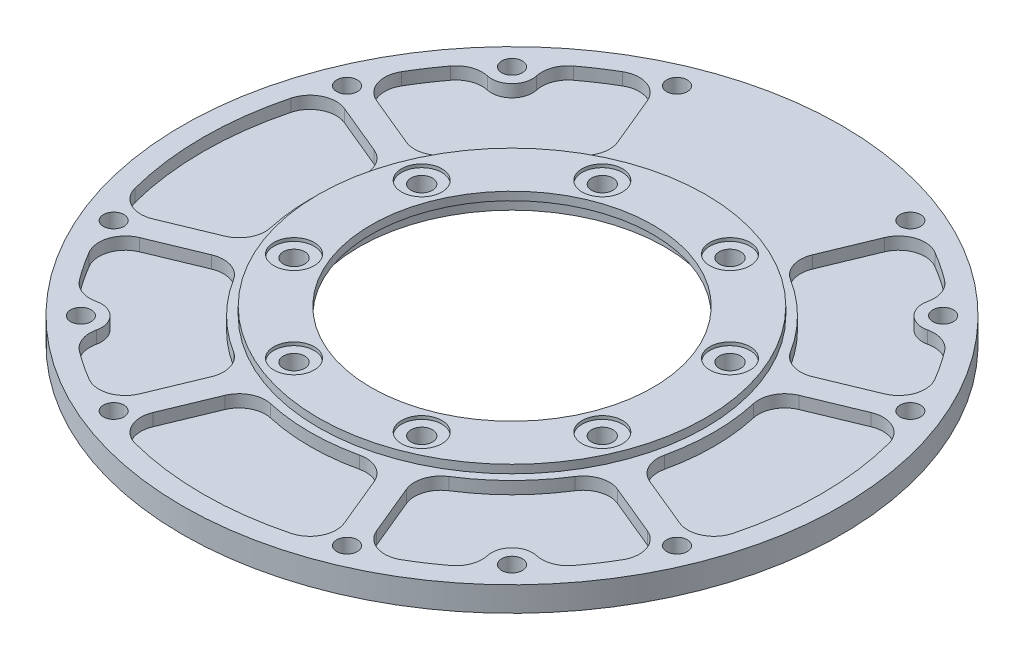
from build123d import *

# Parameters (mm, degrees)
SKETCH_2_R               = 40
EXTRUDE_1_DEPTH          = 4
SKETCH_3_R               = 23.5
EXTRUDE_2_DEPTH          = 1
SKETCH_4_R               = 17.1
CUT_EXTRUDE_1_DEPTH      = 57.789083458
SKETCH_5_R               = 33.5
CUT_EXTRUDE_2_DEPTH      = 1
SKETCH_6_R               = 22.1
CUT_EXTRUDE_3_DEPTH      = 1
SKETCH_7_R               = 18.52
CUT_EXTRUDE_4_DEPTH      = 2
HOLE_WIZARD_M3_1_D       = 2.5
CUT_EXTRUDE_5_DEPTH      = 1.5
PATTERN_CIRCULAR_1_COUNT = 2
PATTERN_CIRCULAR_1_ANGLE = 90
F_1_THE_OTHER_WAY_COUNT  = 2
F_1_THE_OTHER_WAY_ANGLE  = 90
CUT_EXTRUDE_6_DEPTH      = 1.5
PATTERN_CIRCULAR_2_COUNT = 4
CUT_EXTRUDE_7_DEPTH      = 3
FILLET_1_DEPTH           = 2
SKETCH_17_R              = 2.45
CUT_EXTRUDE_8_DEPTH      = 0.4
SKETCH_18_R              = 1.3
CUT_EXTRUDE_9_DEPTH      = 57.755264073
PATTERN_CIRCULAR_3_COUNT = 8
SKETCH_19_W              = 100
SKETCH_19_H              = 100
CUT_EXTRUDE_11_DEPTH     = 1


with BuildPart() as part:
    # 草图2 → 凸台-拉伸1 (new body)
    with BuildSketch(Plane(origin=(0, 0, 0), x_dir=(1, 0, 0), z_dir=(0, 1, 0))):
        with Locations(Location((0, 0, 0), (0, 0, 270))):
            Circle(SKETCH_2_R)
    extrude(amount=EXTRUDE_1_DEPTH)

    # 草图3 → 凸台-拉伸2 (add)
    with BuildSketch(Plane(origin=(0, 4, 0), x_dir=(1, 0, 0), z_dir=(0, 1, 0))):
        with Locations(Location((0, 0, 0), (0, 0, 270))):
            Circle(SKETCH_3_R)
    extrude(amount=EXTRUDE_2_DEPTH)

    # 草图4 → 切除-拉伸1 (cut, through all)
    with BuildSketch(Plane(origin=(0, 5, 0), x_dir=(1, 0, 0), z_dir=(0, 1, 0))):
        with Locations(Location((0, 0, 0), (0, 0, 270))):
            Circle(SKETCH_4_R)
    extrude(amount=-CUT_EXTRUDE_1_DEPTH, mode=Mode.SUBTRACT)

    # 草图5 → 切除-拉伸2 (cut)
    with BuildSketch(Plane.XZ):
        with Locations(Location((0, 0, 0), (0, 0, 270))):
            Circle(SKETCH_5_R)
    extrude(amount=-CUT_EXTRUDE_2_DEPTH, mode=Mode.SUBTRACT)

    # 草图6 → 切除-拉伸3 (cut)
    with BuildSketch(Plane.XZ.offset(-1)):
        with Locations(Location((0, 0, 0), (0, 0, 270))):
            Circle(SKETCH_6_R)
    extrude(amount=-CUT_EXTRUDE_3_DEPTH, mode=Mode.SUBTRACT)

    # 草图7 → 切除-拉伸4 (cut)
    with BuildSketch(Plane.XZ.offset(-2)):
        with Locations(Location((0, 0, 0), (0, 0, 270))):
            Circle(SKETCH_7_R)
    extrude(amount=-CUT_EXTRUDE_4_DEPTH, mode=Mode.SUBTRACT)

    # M3 螺纹孔1 (through all)
    with Locations(Plane(origin=(0, 4, 0), x_dir=(1, 0, 0), z_dir=(0, 1, 0))):
        with Locations((26.162950904, 26.162950904), (-26.162950904, -26.162950904), (-26.162950904, 26.162950904), (26.162950904, -26.162950904), (-14.159286998, 34.183542703), (14.159286998, 34.183542703), (34.183542703, 14.159286998), (34.183542703, -14.159286998), (14.159286998, -34.183542703), (-14.159286998, -34.183542703), (-34.183542703, -14.159286998), (-34.183542703, 14.159286998)):
            Hole(HOLE_WIZARD_M3_1_D / 2)

    # 草图11 → 切除-拉伸5 (cut)
    with BuildSketch(Plane(origin=(0, 4, 0), x_dir=(1, 0, 0), z_dir=(0, 1, 0))):
        with BuildLine():
            Line((-9.060807589, -25.794413462), (-11.616409968, -31.964183385))
            ThreePointArc((-11.616409968, -31.964183385), (-11.525331247, -34.613498711), (-9.46792507, -36.285098799))
            ThreePointArc((-9.46792507, -36.285098799), (0, -37.5), (9.46792507, -36.285098799))
            ThreePointArc((9.46792507, -36.285098799), (11.525331247, -34.613498711), (11.616409968, -31.964183385))
            Line((11.616409968, -31.964183385), (9.060807589, -25.794413462))
            ThreePointArc((9.060807589, -25.794413462), (7.576262006, -24.177592013), (5.39919244, -23.897671874))
            ThreePointArc((5.39919244, -23.897671874), (0, -24.5), (-5.39919244, -23.897671874))
            ThreePointArc((-5.39919244, -23.897671874), (-7.576262006, -24.177592013), (-9.060807589, -25.794413462))
        make_face()
    cut_extrude_5 = extrude(amount=-CUT_EXTRUDE_5_DEPTH, mode=Mode.SUBTRACT)

    # 阵列(圆周)1: 切除-拉伸5 ×2 about axis
    pattern_circular_1_axis = Axis((0, 0, 0), (0, 1, 0))
    for i in range(1, PATTERN_CIRCULAR_1_COUNT):
        add(cut_extrude_5.rotate(pattern_circular_1_axis, i * PATTERN_CIRCULAR_1_ANGLE / (PATTERN_CIRCULAR_1_COUNT - 1)), mode=Mode.SUBTRACT)

    # 1 the other way: 切除-拉伸5 ×2 about axis
    f_1_the_other_way_axis = Axis((0, 0, 0), (0, -1, 0))
    for i in range(1, F_1_THE_OTHER_WAY_COUNT):
        add(cut_extrude_5.rotate(f_1_the_other_way_axis, i * F_1_THE_OTHER_WAY_ANGLE / (F_1_THE_OTHER_WAY_COUNT - 1)), mode=Mode.SUBTRACT)

    # 草图15 → 切除-拉伸6 (cut)
    with BuildSketch(Plane(origin=(0, 4, 0), x_dir=(1, 0, 0), z_dir=(0, 1, 0))):
        with BuildLine():
            Line((-24.646363165, -11.832446186), (-30.816133088, -14.388048565))
            ThreePointArc((-30.816133088, -14.388048565), (-32.625079539, -16.325799779), (-32.352273438, -18.962605396))
            ThreePointArc((-32.352273438, -18.962605396), (-31.217265421, -20.778169786), (-29.980485961, -22.52599524))
            ThreePointArc((-29.980485961, -22.52599524), (-28.524951236, -23.607746352), (-26.715231717, -23.724716727))
            ThreePointArc((-26.715231717, -23.724716727), (-24.395183951, -24.395183951), (-23.724716727, -26.715231717))
            ThreePointArc((-23.724716727, -26.715231717), (-23.607746352, -28.524951236), (-22.52599524, -29.980485961))
            ThreePointArc((-22.52599524, -29.980485961), (-20.778169786, -31.217265421), (-18.962605396, -32.352273438))
            ThreePointArc((-18.962605396, -32.352273438), (-16.325799779, -32.625079539), (-14.388048565, -30.816133088))
            Line((-14.388048565, -30.816133088), (-11.832446186, -24.646363165))
            ThreePointArc((-11.832446186, -24.646363165), (-11.738913025, -22.453365506), (-13.08040025, -20.716011424))
            ThreePointArc((-13.08040025, -20.716011424), (-17.324116139, -17.324116139), (-20.716011424, -13.08040025))
            ThreePointArc((-20.716011424, -13.08040025), (-22.453365506, -11.738913025), (-24.646363165, -11.832446186))
        make_face()
    cut_extrude_6 = extrude(amount=-CUT_EXTRUDE_6_DEPTH, mode=Mode.SUBTRACT)

    # 阵列(圆周)2: 切除-拉伸6 ×4 about axis
    pattern_circular_2_axis = Axis((0, 0, 0), (0, 1, 0))
    for i in range(1, PATTERN_CIRCULAR_2_COUNT):
        add(cut_extrude_6.rotate(pattern_circular_2_axis, i * 360 / PATTERN_CIRCULAR_2_COUNT), mode=Mode.SUBTRACT)

    # 草图16 → 切除-拉伸7 (cut)
    with BuildSketch(Plane.XZ):
        with BuildLine():
            Line((-7, -23.821209037), (-7, -36.485613603))
            ThreePointArc((-7, -36.485613603), (-6.453980705, -37.936250645), (-5.086956522, -38.666818764))
            ThreePointArc((-5.086956522, -38.666818764), (0, -39), (5.086956522, -38.666818764))
            ThreePointArc((5.086956522, -38.666818764), (6.453980705, -37.936250645), (7, -36.485613603))
            Line((7, -36.485613603), (7, -23.821209037))
            ThreePointArc((7, -23.821209037), (6.193547742, -22.11885047), (4.365432099, -21.664556367))
            ThreePointArc((4.365432099, -21.664556367), (0, -22.1), (-4.365432099, -21.664556367))
            ThreePointArc((-4.365432099, -21.664556367), (-6.193547742, -22.11885047), (-7, -23.821209037))
        make_face()
    extrude(amount=-CUT_EXTRUDE_7_DEPTH, mode=Mode.SUBTRACT)

    # 圆角1: read off the stored shape, not the designer's step
    # 圆角1 outline → 圆角1 (cut)
    with BuildSketch(Plane(origin=(0, 0, 0), x_dir=(1, 0, 0), z_dir=(0, 1, 0))):
        with BuildLine():
            ThreePointArc((-4.365432099, 21.664556367), (-5.288780383, 21.676193014), (-6.126015716, 22.06573693))
            ThreePointArc((-6.126015716, 22.06573693), (-5.935396115, 21.57760895), (-6.285184187, 21.187412766))
            ThreePointArc((-6.285184187, 21.187412766), (-5.330649428, 21.447474832), (-4.365432099, 21.664556367))
        make_face()
        with BuildLine():
            ThreePointArc((4.365432099, 21.664556367), (5.330649428, 21.447474832), (6.285184187, 21.187412766))
            ThreePointArc((6.285184187, 21.187412766), (5.935396115, 21.57760895), (6.126015716, 22.06573693))
            ThreePointArc((6.126015716, 22.06573693), (5.288780383, 21.676193014), (4.365432099, 21.664556367))
        make_face()
    extrude(amount=FILLET_1_DEPTH, mode=Mode.SUBTRACT)

    # 草图17 → 切除-拉伸8 (cut)
    with BuildSketch(Plane(origin=(0, 5, 0), x_dir=(1, 0, 0), z_dir=(0, 1, 0))):
        with Locations(Location((7.749339505, -18.708560533, 0), (0, 0, 270))):
            Circle(SKETCH_17_R)
    cut_extrude_8 = extrude(amount=-CUT_EXTRUDE_8_DEPTH, mode=Mode.SUBTRACT)

    # 草图18 → 切除-拉伸9 (cut, through all)
    with BuildSketch(Plane(origin=(0, 4.6, 0), x_dir=(1, 0, 0), z_dir=(0, 1, 0))):
        with Locations(Location((7.749339505, -18.708560533, 0), (0, 0, 270))):
            Circle(SKETCH_18_R)
    cut_extrude_9 = extrude(amount=-CUT_EXTRUDE_9_DEPTH, mode=Mode.SUBTRACT)

    # 阵列(圆周)3: 切除-拉伸8, 切除-拉伸9 ×8 about axis
    pattern_circular_3_axis = Axis((0, 0, 0), (0, 1, 0))
    add([cut_extrude_8.rotate(pattern_circular_3_axis, i * 360 / PATTERN_CIRCULAR_3_COUNT) for i in range(1, PATTERN_CIRCULAR_3_COUNT)], mode=Mode.SUBTRACT)
    add([cut_extrude_9.rotate(pattern_circular_3_axis, i * 360 / PATTERN_CIRCULAR_3_COUNT) for i in range(1, PATTERN_CIRCULAR_3_COUNT)], mode=Mode.SUBTRACT)

    # 草图19 → 切除-拉伸11 (cut)
    with BuildSketch(Plane.XZ):
        Rectangle(SKETCH_19_W, SKETCH_19_H)
    extrude(amount=-CUT_EXTRUDE_11_DEPTH, mode=Mode.SUBTRACT)


solid = part.part
